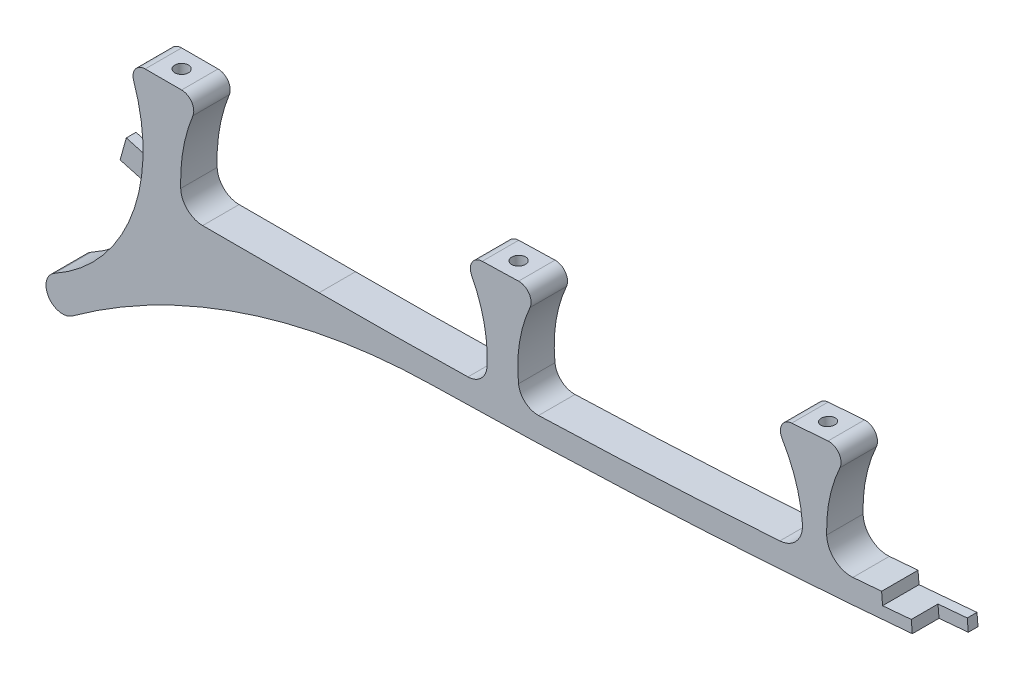
from build123d import *

# Parameters (mm, degrees)
BOSS_EXTRUDE5_START      = -4.7625
BOSS_EXTRUDE5_DEPTH      = 9.525
SKETCH6_R                = 1.778
CUT_EXTRUDE3_DEPTH       = 504.714306696
SKETCH10_R               = 1.778
CUT_EXTRUDE6_DEPTH       = 502.305599176
CUT_EXTRUDE11_DEPTH      = 3.556
CUT_EXTRUDE11_DEPTH_BACK = 499.112065171
SKETCH12_R               = 3.175
SKETCH13_R               = 1.778
CUT_EXTRUDE12_DEPTH      = 500.23676844
CUT_EXTRUDE13_DEPTH      = 6.35
CUT_EXTRUDE13_DEPTH_BACK = 497.697496023
SKETCH14_R               = 3.175
CUT_EXTRUDE14_DEPTH      = 3.556
CUT_EXTRUDE14_DEPTH_BACK = 502.048406711
SKETCH16_R               = 3.175
BOSS_EXTRUDE8_START      = -2.54
BOSS_EXTRUDE8_DEPTH      = 2.54


# Read off the part's stored shape, not the designer's step: Boss-Extrude5
with BuildPart() as part:
    # Boss-Extrude5 outline → Boss-Extrude5 (new body)
    with BuildSketch(Plane(origin=(0, 0, 4.097149242), x_dir=(-1, 0, 0), z_dir=(0, 0, -1)).offset(BOSS_EXTRUDE5_START)):
        with BuildLine():
            add(Edge.make_bspline(
                [(393.904705106, -64.802061588), (391.448326364, -64.761983229), (369.283277897, -64.354767178), (332.573121161, -62.998956248), (298.370755587, -60.752959194), (283.854357877, -59.621991507)],
                knots=[0.399403863, 0.399403863, 0.399403863, 0.399403863, 0.415007942, 0.540214574, 0.632697153, 0.632697153, 0.632697153, 0.632697153], degree=3))
            ThreePointArc((393.904705106, -64.802061588), (443.288872323, -73.243905657), (487.836271638, -96.169655094))
            ThreePointArc((487.836271638, -96.169655094), (494.061542174, -94.986942251), (492.499924864, -88.845757162))
            ThreePointArc((492.499924864, -88.845757162), (472.347982204, -65.669309605), (471.824439099, -34.961421092))
            ThreePointArc((471.824439099, -34.961421092), (471.408544547, -32.082865726), (468.823110549, -30.750731982))
            Line((468.823110549, -30.750731982), (459.298110549, -30.750731982))
            ThreePointArc((459.298110549, -30.750731982), (456.664489609, -32.15241144), (456.356218194, -35.119840174))
            ThreePointArc((456.356218194, -35.119840174), (458.901914687, -43.970050893), (459.537600747, -53.157145299))
            ThreePointArc((459.537600747, -53.157145299), (457.784815205, -57.082003794), (453.798743833, -58.690731982))
            Line((453.798743833, -58.690731982), (423.379813152, -58.69073219))
            add(Edge.make_bspline(
                [(384.460672275, -58.271606449), (385.229576489, -58.288261834), (398.200840977, -58.560856767), (411.17870293, -58.692207634), (423.379813152, -58.69073219)],
                knots=[0.583960389, 0.583960389, 0.583960389, 0.583960389, 0.588862683, 0.666659483, 0.666659483, 0.666659483, 0.666659483], degree=3))
            ThreePointArc((384.460672275, -58.271606449), (381.017085608, -56.831406643), (379.475487665, -53.432003695))
            ThreePointArc((379.475487665, -53.432003695), (380.246820348, -43.884748581), (383.481055682, -34.868942675))
            ThreePointArc((383.481055682, -34.868942675), (383.390574332, -31.793909155), (380.736068027, -30.23904122))
            add(Edge.make_bspline(
                [(371.231646974, -29.984054972), (374.399550345, -30.077611409), (377.567706075, -30.162607104), (380.736068027, -30.23904122)],
                knots=[0.554089987, 0.554089987, 0.554089987, 0.554089987, 0.574612442, 0.574612442, 0.574612442, 0.574612442], degree=3))
            ThreePointArc((371.231646974, -29.984054972), (368.497590279, -31.394357567), (368.242362728, -34.460116711))
            ThreePointArc((368.242362728, -34.460116711), (370.988538335, -43.636366014), (371.246859304, -53.211244668))
            ThreePointArc((371.246859304, -53.211244668), (369.525210394, -56.523100632), (366.009356719, -57.776590868))
            add(Edge.make_bspline(
                [(302.95547422, -54.643284316), (305.9011715, -54.841877501), (317.490683468, -55.594370094), (337.736625716, -56.710847247), (355.814849648, -57.444307809), (365.24066472, -57.751995195), (366.009356719, -57.776590868)],
                knots=[0.410597603, 0.410597603, 0.410597603, 0.410597603, 0.429416671, 0.484628218, 0.539839764, 0.544742054, 0.544742054, 0.544742054, 0.544742054], degree=3))
            ThreePointArc((302.95547422, -54.643284316), (298.577428951, -52.458900104), (297.052141363, -47.809995658))
            ThreePointArc((297.052141363, -47.809995658), (298.741043629, -39.209557534), (302.353410859, -31.223899778))
            ThreePointArc((302.353410859, -31.223899778), (302.446551024, -28.124116994), (299.853176371, -26.423606391))
            add(Edge.make_bspline(
                [(290.370558291, -25.731509235), (293.530799834, -25.970748987), (296.691687874, -26.201449108), (299.853176371, -26.423606391)],
                knots=[0.379296829, 0.379296829, 0.379296829, 0.379296829, 0.399819291, 0.399819291, 0.399819291, 0.399819291], degree=3))
            ThreePointArc((290.370558291, -25.731509235), (287.523350949, -27.0859922), (287.247618484, -30.226881462))
            ThreePointArc((287.247618484, -30.226881462), (289.965925573, -38.51215819), (290.723609817, -47.198982609))
            ThreePointArc((290.723609817, -47.198982609), (288.61383932, -51.750218303), (283.859337385, -53.350089939))
            Line((283.859337385, -53.350089939), (276.361704846, -52.737902091))
            Line((276.361704846, -52.737902091), (276.104683524, -55.885712738))
            Line((276.104683524, -55.885712738), (268.602599978, -55.235621039))
            Line((268.602599978, -55.235621039), (268.333167883, -58.344877914))
            Line((268.333167883, -58.344877914), (283.854357877, -59.621991507))
        make_face()
    extrude(amount=BOSS_EXTRUDE5_DEPTH)

    # Sketch6 → Cut-Extrude3 (cut, through all)
    with BuildSketch(Plane(origin=(0.329495605, -4.514512092, 0), x_dir=(0.9973471252705134, 0.07279225037490757, 0), z_dir=(-0.07279225037490757, 0.9973471252705134, 0))):
        with Locations(Location((-296.227216633, -4.097149242, 0), (0, 0, 180))):
            Circle(SKETCH6_R)
    extrude(amount=-CUT_EXTRUDE3_DEPTH, mode=Mode.SUBTRACT)

    # Sketch10 → Cut-Extrude6 (cut, through all)
    with BuildSketch(Plane(origin=(0.536837, -20.010175041, 0), x_dir=(0.9996403179621594, 0.026818551499160636, 0), z_dir=(-0.026818551499160636, 0.9996403179621594, 0))):
        with Locations(Location((-376.656170964, -4.097149242, 0), (0, 0, 180))):
            Circle(SKETCH10_R)
    extrude(amount=-CUT_EXTRUDE6_DEPTH, mode=Mode.SUBTRACT)

    # Sketch12 → Cut-Extrude11 (cut, two sides: drawn at the far end of the back side and taken through both)
    with BuildSketch(Plane(origin=(1.456593089, -54.293356553, 0), x_dir=(0.9996403179621594, 0.026818551499160636, 0), z_dir=(-0.026818551499160636, 0.9996403179621594, 0)).offset(-CUT_EXTRUDE11_DEPTH_BACK)):
        with Locations(Location((-376.656171029, -4.097149242, 0), (0, 0, 180))):
            Circle(SKETCH12_R)
    extrude(amount=CUT_EXTRUDE11_DEPTH + CUT_EXTRUDE11_DEPTH_BACK, mode=Mode.SUBTRACT)

    # Sketch13 → Cut-Extrude12 (cut, through all)
    with BuildSketch(Plane(origin=(0, -30.750731982, 0), x_dir=(1, 0, 0), z_dir=(0, 1, 0))):
        with Locations(Location((-464.060610549, -4.097149242, 0), (0, 0, 270))):
            Circle(SKETCH13_R)
    extrude(amount=-CUT_EXTRUDE12_DEPTH, mode=Mode.SUBTRACT)

    # Sketch14 → Cut-Extrude13 (cut, two sides: drawn at the far end of the back side and taken through both)
    with BuildSketch(Plane(origin=(0, -68.850731982, 0), x_dir=(1, 0, 0), z_dir=(0, 1, 0)).offset(-CUT_EXTRUDE13_DEPTH_BACK)):
        with Locations(Location((-464.060610549, -4.097149242, 0), (0, 0, 270))):
            Circle(SKETCH14_R)
    extrude(amount=CUT_EXTRUDE13_DEPTH + CUT_EXTRUDE13_DEPTH_BACK, mode=Mode.SUBTRACT)

    # Sketch16 → Cut-Extrude14 (cut, two sides: drawn at the far end of the back side and taken through both)
    with BuildSketch(Plane(origin=(2.82554187, -38.713545018, 0), x_dir=(0.9973471252705134, 0.07279225037490757, 0), z_dir=(-0.07279225037490757, 0.9973471252705134, 0)).offset(-CUT_EXTRUDE14_DEPTH_BACK)):
        with Locations(Location((-296.227216633, -4.097149242, 0), (0, 0, 180))):
            Circle(SKETCH16_R)
    extrude(amount=CUT_EXTRUDE14_DEPTH + CUT_EXTRUDE14_DEPTH_BACK, mode=Mode.SUBTRACT)

    # Sketch17 → Boss-Extrude8 (add)
    with BuildSketch(Plane(origin=(0, 0, -0.665350758), x_dir=(-1, 0, 0), z_dir=(0, 0, -1)).offset(BOSS_EXTRUDE8_START)):
        Polygon((480.741163163, -55.807148253), (482.353687842, -61.5964138), (471.918866371, -64.502897707), (470.306341692, -58.71363216), align=None)
        Polygon((268.602599978, -55.235621039), (260.960708561, -54.573414315), (260.691276466, -57.68267119), (268.333167883, -58.344877914), align=None)
        with BuildLine():
            ThreePointArc((471.918866371, -64.502897707), (471.01556343, -61.635294332), (470.306341692, -58.71363216))
            Line((470.306341692, -58.71363216), (468.875088895, -59.112289025))
            Line((468.875088895, -59.112289025), (470.487613574, -64.901554572))
            Line((470.487613574, -64.901554572), (471.918866371, -64.502897707))
        make_face()
        with BuildLine():
            Line((471.918866371, -64.502897707), (470.306341692, -58.71363216))
            ThreePointArc((470.306341692, -58.71363216), (471.01556343, -61.635294332), (471.918866371, -64.502897707))
        make_face()
    extrude(amount=BOSS_EXTRUDE8_DEPTH)


solid = part.part
